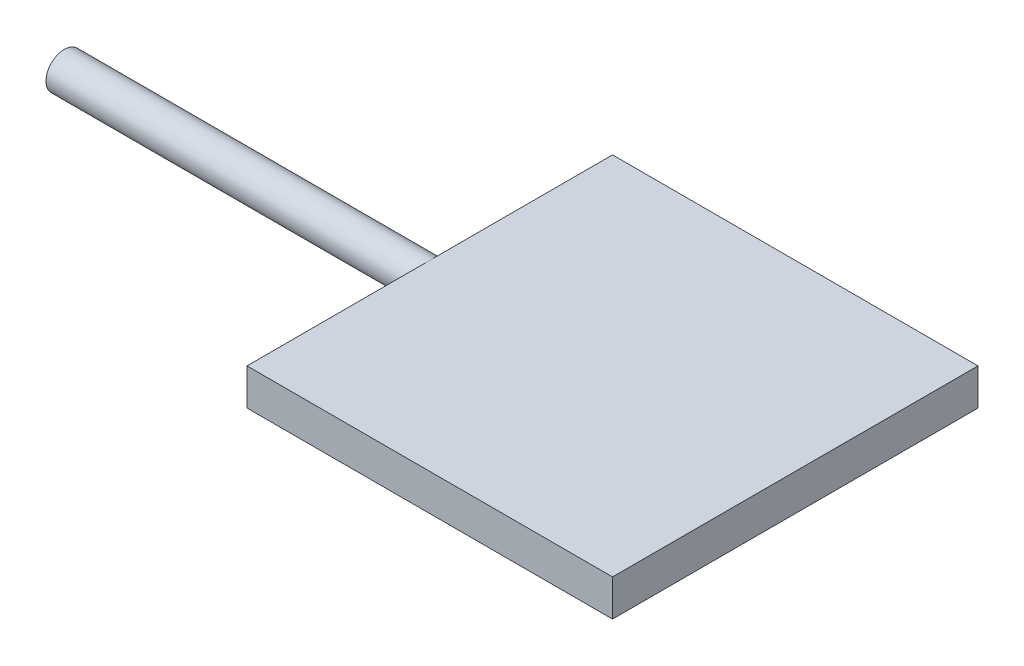
from build123d import *

# Parameters (mm, degrees)
CROQUIS1_W              = 100
CROQUIS1_H              = 100
SALIENTE_EXTRUIR1_DEPTH = 10
CROQUIS2_R              = 5
SALIENTE_EXTRUIR2_DEPTH = 100


with BuildPart() as part:
    # Croquis1 → Saliente-Extruir1 (new body)
    with BuildSketch(Plane(origin=(0, 0, 0), x_dir=(1, 0, 0), z_dir=(0, 1, 0))):
        with Locations((50, 50)):
            Rectangle(CROQUIS1_W, CROQUIS1_H)
    extrude(amount=SALIENTE_EXTRUIR1_DEPTH)

    # Croquis2 → Saliente-Extruir2 (add)
    with BuildSketch(Plane.ZY):
        with Locations((-50, 5)):
            Circle(CROQUIS2_R)
    extrude(amount=SALIENTE_EXTRUIR2_DEPTH)


solid = part.part
